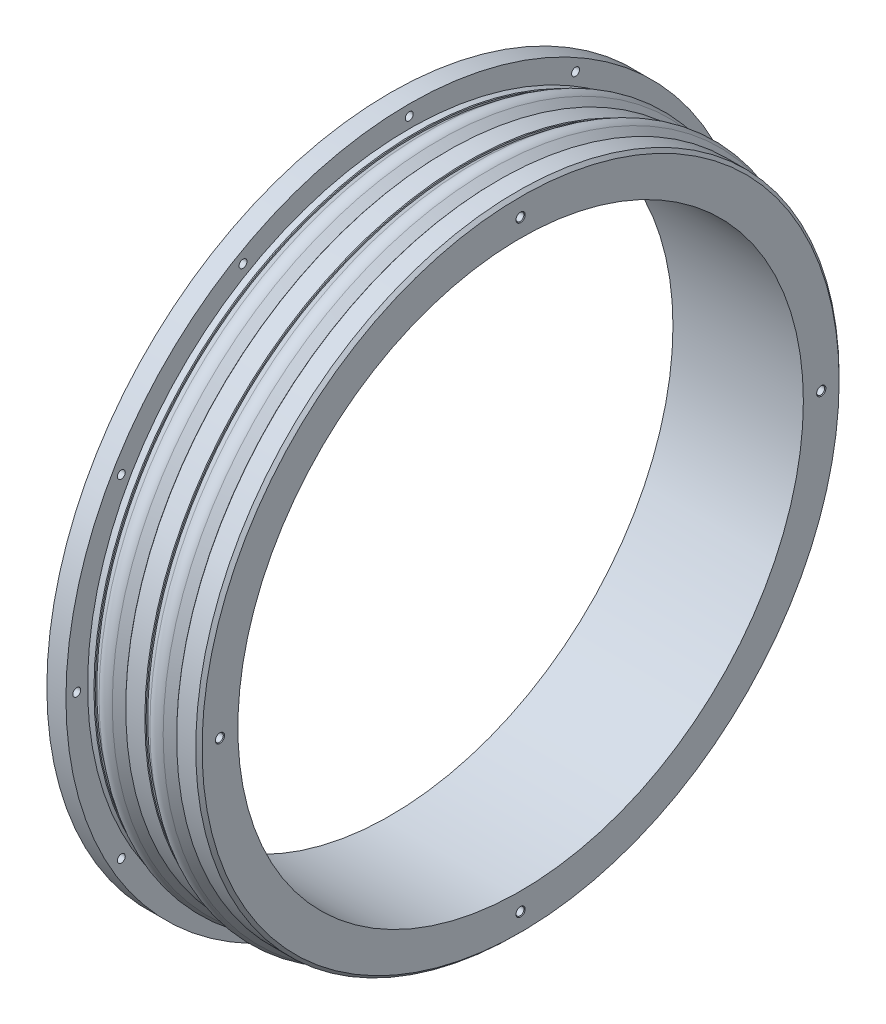
from build123d import *

# Parameters (mm, degrees)
CHAMFER1_SIZE                   = 1
CHAMFER2_SIZE                   = 0.2
TAP_DRILL_FOR_M3X0_5_TAP2_D     = 2.5
TAP_DRILL_FOR_M3X0_5_TAP3_D     = 2.5
TAP_DRILL_FOR_M3X0_5_TAP3_DEPTH = 4
TAP_DRILL_FOR_M3X0_5_TAP3_TIP   = 0.751075774
CHAMFER3_SIZE                   = 0.2
CHAMFER4_SIZE                   = 0.2


with BuildPart() as part:
    # Sketch2 → Revolve1 (revolve)
    with BuildSketch(Plane(origin=(0, 0, 0), x_dir=(1, 0, 0), z_dir=(0, 1, 0))):
        with BuildLine():
            Line((0, 98.171), (0, 88.9))
            Line((0, 88.9), (41, 88.9))
            Line((41, 88.9), (41, 101.15))
            Line((41, 101.15), (33.8, 101.15))
            Line((33.8, 101.15), (33.8, 100.45))
            Line((33.8, 100.45), (31.083348005, 102.46241197))
            ThreePointArc((31.083348005, 102.46241197), (29, 103.15), (26.916651995, 102.46241197))
            Line((26.916651995, 102.46241197), (24.2, 100.45))
            Line((24.2, 100.45), (24.2, 101.15))
            Line((24.2, 101.15), (17.8, 101.15))
            Line((17.8, 101.15), (17.8, 100.45))
            Line((17.8, 100.45), (15.083348005, 102.46241197))
            ThreePointArc((15.083348005, 102.46241197), (13, 103.15), (10.916651995, 102.46241197))
            Line((10.916651995, 102.46241197), (8.2, 100.45))
            Line((8.2, 100.45), (8.2, 101.15))
            Line((8.2, 101.15), (6, 101.15))
            Line((6, 101.15), (6, 107.95))
            Line((6, 107.95), (0, 107.95))
            Line((0, 107.95), (0, 101.27))
            Line((0, 101.27), (0.75, 101.27))
            Line((0.75, 101.27), (0.011318739, 100.728889803))
            ThreePointArc((0.011318739, 100.728889803), (-0.5, 99.7205), (0.011318739, 98.712110197))
            Line((0.011318739, 98.712110197), (0.75, 98.171))
            Line((0.75, 98.171), (0, 98.171))
        make_face()
    revolve(axis=Axis((0, 0, 0), (-1, 0, 0)))

    # Chamfer1
    chamfer1_edges = [part.edges().sort_by_distance(p)[0] for p in [
        (41, 0, 101.15),
    ]]
    chamfer(chamfer1_edges, length=CHAMFER1_SIZE)

    # Chamfer2
    chamfer2_edges = [part.edges().sort_by_distance(p)[0] for p in [
        (0, 0, 98.171),
        (0, 0, 101.27),
        (33.8, 0, 101.15),
        (24.2, 0, 101.15),
        (17.8, 0, 101.15),
        (8.2, 0, 101.15),
    ]]
    chamfer(chamfer2_edges, length=CHAMFER2_SIZE)

    # Tap Drill for M3x0.5 Tap2 (through all)
    with Locations(Plane(origin=(6, 104.55, 0), x_dir=(0, 0, 1), z_dir=(1, 0, 0))):
        with Locations((0, 0), (-52.275, 14.007044034), (-90.542955966, 52.275), (-104.55, 104.55), (-90.542955966, 156.825), (-52.275, 195.092955966), (0, 209.1), (52.275, 195.092955966), (90.542955966, 156.825), (104.55, 104.55), (90.542955966, 52.275), (52.275, 14.007044034)):
            Hole(TAP_DRILL_FOR_M3X0_5_TAP2_D / 2)

    # Tap Drill for M3x0.5 Tap3
    with Locations(Plane(origin=(41, 94.525, 0), x_dir=(0, 0, 1), z_dir=(1, 0, 0))):
        with Locations((0, 0), (-94.525, 94.525), (0, 189.05), (94.525, 94.525)):
            Hole(TAP_DRILL_FOR_M3X0_5_TAP3_D / 2, depth=TAP_DRILL_FOR_M3X0_5_TAP3_DEPTH)
            with Locations((0, 0, -(TAP_DRILL_FOR_M3X0_5_TAP3_DEPTH + TAP_DRILL_FOR_M3X0_5_TAP3_TIP / 2))):  # 118° drill point
                Cone(0, TAP_DRILL_FOR_M3X0_5_TAP3_D / 2, TAP_DRILL_FOR_M3X0_5_TAP3_TIP, mode=Mode.SUBTRACT)

    # Chamfer3
    chamfer3_edges = [part.edges().sort_by_distance(p)[0] for p in [
        (41, 0, 95.775),
        (41, -94.525, 1.25),
        (41, 0, -93.275),
        (41, 94.525, 1.25),
    ]]
    chamfer(chamfer3_edges, length=CHAMFER3_SIZE)

    # Chamfer4
    chamfer4_edges = [part.edges().sort_by_distance(p)[0] for p in [
        (0, -52.275, -89.292955966),
        (0, -90.542955966, -51.025),
        (0, -104.55, 1.25),
        (0, -90.542955966, 53.525),
        (0, -52.275, 91.792955966),
        (0, 0, 105.8),
        (0, 52.275, 91.792955966),
        (0, 90.542955966, 53.525),
        (0, 104.55, 1.25),
        (0, 90.542955966, -51.025),
        (0, 52.275, -89.292955966),
        (0, 0, -103.3),
    ]]
    chamfer(chamfer4_edges, length=CHAMFER4_SIZE)


solid = part.part
